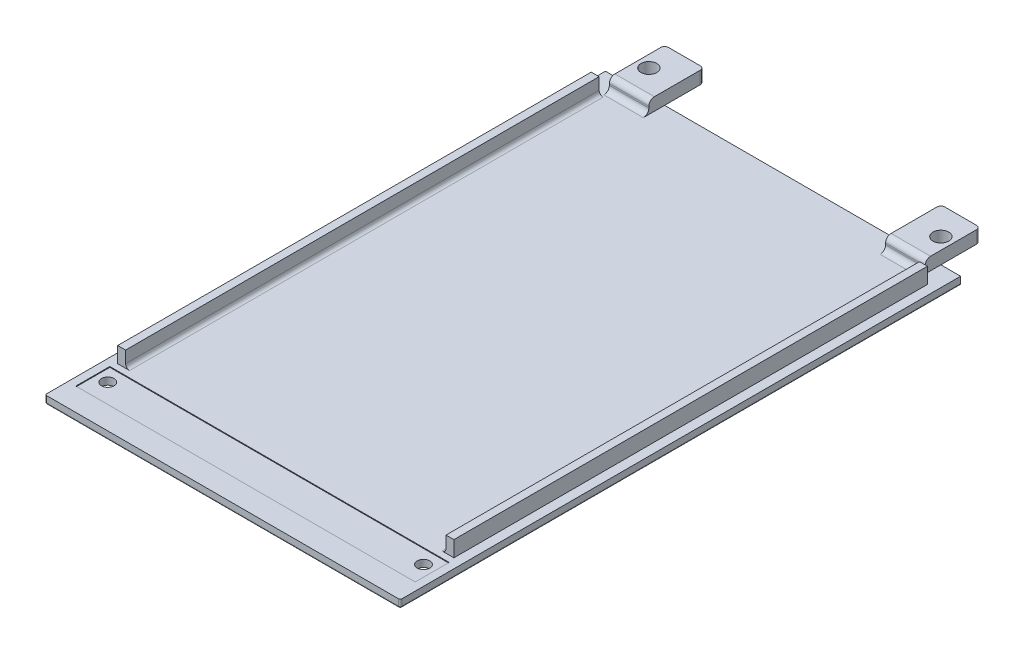
from build123d import *

# Parameters (mm, degrees)
SKETCH1_W           = 90
SKETCH1_H           = 2
BOSS_EXTRUDE1_DEPTH = 142
FILLET1_R           = 0.4
SKETCH2_W           = 10
SKETCH2_H           = 14
BOSS_EXTRUDE2_DEPTH = 3.2
SKETCH3_R           = 2
CUT_EXTRUDE10_DEPTH = 3.2
SKETCH4_R           = 1.6
CUT_EXTRUDE11_DEPTH = 169.149457329
SKETCH5_W           = 2
SKETCH5_H           = 120
BOSS_EXTRUDE3_DEPTH = 4
SKETCH6_W           = 86
SKETCH6_H           = 8.6
CUT_EXTRUDE12_DEPTH = 0.2
FILLET2_R           = 1.4
FILLET4_R           = 1
FILLET5_R           = 1


with BuildPart() as part:
    # Sketch1 → Boss-Extrude1 (new body)
    with BuildSketch(Plane.XY):
        with Locations((45, 1)):
            Rectangle(SKETCH1_W, SKETCH1_H)
    extrude(amount=BOSS_EXTRUDE1_DEPTH)

    # Fillet1
    fillet1_edges = [part.edges().sort_by_distance(p)[0] for p in [
        (45, 0, 142),
        (0, 0, 71),
        (90, 0, 71),
        (0, 1, 142),
        (90, 1, 142),
    ]]
    fillet(fillet1_edges, radius=FILLET1_R)

    # Sketch2 → Boss-Extrude2 (add)
    with BuildSketch(Plane(origin=(0, 2, 0), x_dir=(1, 0, 0), z_dir=(0, 1, 0))):
        with Locations((10, 3)):
            Rectangle(SKETCH2_W, SKETCH2_H)
        with Locations((80, 3)):
            Rectangle(SKETCH2_W, SKETCH2_H)
    extrude(amount=BOSS_EXTRUDE2_DEPTH)

    # Sketch3 → Cut-Extrude10 (cut)
    with BuildSketch(Plane.XZ.offset(-2)):
        with Locations((8, -3)):
            Circle(SKETCH3_R)
        with Locations((82, -3)):
            Circle(SKETCH3_R)
    extrude(amount=-CUT_EXTRUDE10_DEPTH, mode=Mode.SUBTRACT)

    # Sketch4 → Cut-Extrude11 (cut, through all)
    with BuildSketch(Plane(origin=(0, 2, 0), x_dir=(1, 0, 0), z_dir=(0, 1, 0))):
        with Locations((5, -131.1)):
            Circle(SKETCH4_R)
        with Locations((85, -131.1)):
            Circle(SKETCH4_R)
    extrude(amount=-CUT_EXTRUDE11_DEPTH, mode=Mode.SUBTRACT)

    # Sketch5 → Boss-Extrude3 (add)
    with BuildSketch(Plane(origin=(0, 2, 0), x_dir=(1, 0, 0), z_dir=(0, 1, 0))):
        with Locations((3.4, -66)):
            Rectangle(SKETCH5_W, SKETCH5_H)
        with Locations((86.6, -66)):
            Rectangle(SKETCH5_W, SKETCH5_H)
    extrude(amount=BOSS_EXTRUDE3_DEPTH)

    # Sketch6 → Cut-Extrude12 (cut)
    with BuildSketch(Plane(origin=(0, 2, 0), x_dir=(1, 0, 0), z_dir=(0, 1, 0))):
        with Locations((45, -131.9)):
            Rectangle(SKETCH6_W, SKETCH6_H)
    extrude(amount=-CUT_EXTRUDE12_DEPTH, mode=Mode.SUBTRACT)

    # Fillet2
    fillet2_edges = [part.edges().sort_by_distance(p)[0] for p in [
        (10, 5.2, 4),
        (10, 2, 4),
        (80, 5.2, 4),
        (80, 2, 4),
    ]]
    fillet(fillet2_edges, radius=FILLET2_R)

    # Fillet4
    fillet4_edges = [part.edges().sort_by_distance(p)[0] for p in [
        (75, 3.6, -10),
        (85, 3.6, -10),
        (15, 3.6, -10),
        (5, 3.6, -10),
    ]]
    fillet(fillet4_edges, radius=FILLET4_R)

    # Fillet5
    fillet5_edges = [part.edges().sort_by_distance(p)[0] for p in [
        (85.6, 2, 66),
        (4.4, 2, 66),
    ]]
    fillet(fillet5_edges, radius=FILLET5_R)


solid = part.part
